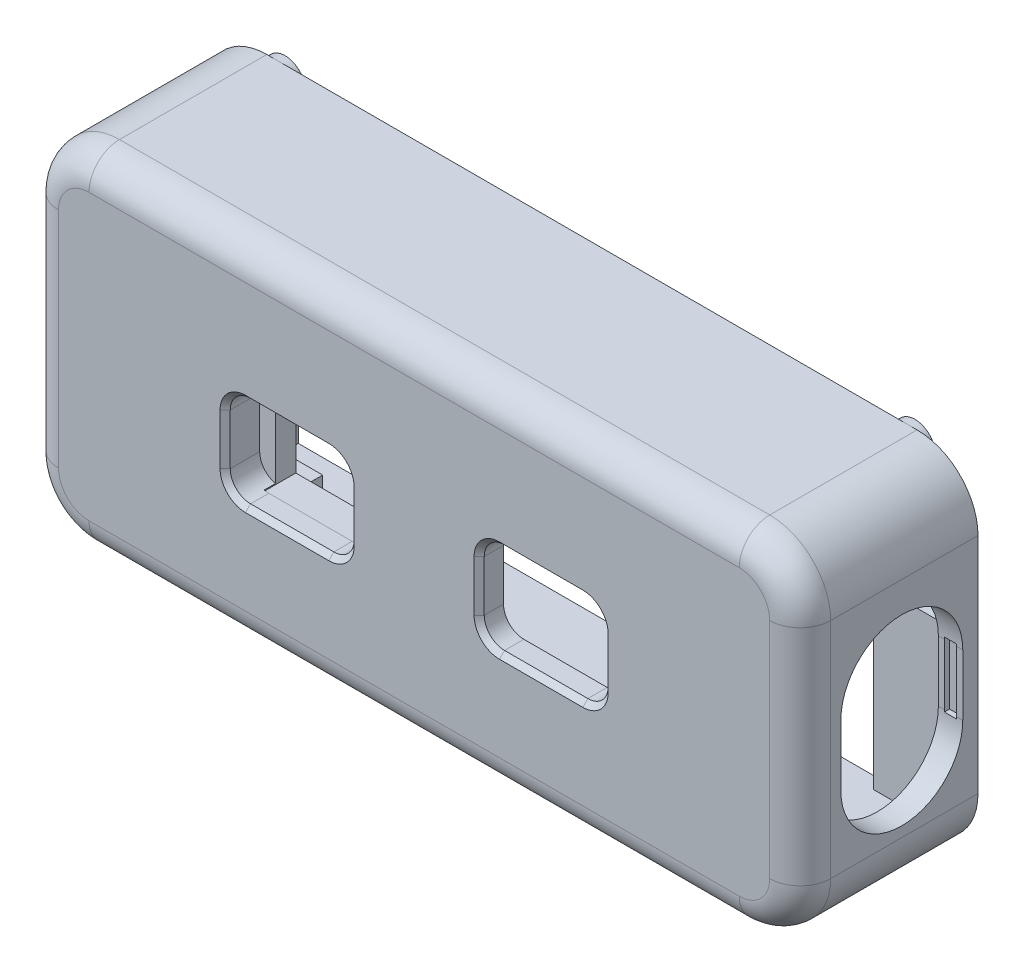
from build123d import *

# Parameters (mm, degrees)
BOSS_EXTRUDE1_START  = 80.8
BOSS_EXTRUDE1_DEPTH  = 17.5
FILLET1_R            = 3
BOSS_EXTRUDE2_START  = 79.8
BOSS_EXTRUDE2_DEPTH  = 16.1
BOSS_EXTRUDE3_START  = 80.8
SKETCH3_W            = 7.2
SKETCH3_H            = 6.31
BOSS_EXTRUDE3_DEPTH  = 6
BOSS_EXTRUDE4_START  = 65.3
BOSS_EXTRUDE4_DEPTH  = 6.31
BOSS_EXTRUDE5_START  = 80.8
SKETCH5_W            = 6.71
SKETCH5_H            = 17.61
BOSS_EXTRUDE5_DEPTH  = 1.2
BOSS_EXTRUDE6_START  = 85.3
SKETCH6_W            = 4
SKETCH6_H            = 3.01
BOSS_EXTRUDE6_DEPTH  = 2
BOSS_EXTRUDE7_START  = 85.3
SKETCH7_W            = 4
SKETCH7_H            = 3.01
BOSS_EXTRUDE7_DEPTH  = 2
BOSS_EXTRUDE8_START  = -39
BOSS_EXTRUDE8_DEPTH  = 3.9
BOSS_EXTRUDE9_START  = 81.8
SKETCH9_W            = 1.2
SKETCH9_H            = 6.4
BOSS_EXTRUDE9_DEPTH  = 0.6
BOSS_EXTRUDE10_START = 94.2
SKETCH10_W           = 1.2
SKETCH10_H           = 6.4
BOSS_EXTRUDE10_DEPTH = 0.6
BOSS_EXTRUDE11_START = 80.8
SKETCH11_W           = 7.2
SKETCH11_H           = 6.31
BOSS_EXTRUDE11_DEPTH = 6
BOSS_EXTRUDE12_START = 65.3
BOSS_EXTRUDE12_DEPTH = 6.31
BOSS_EXTRUDE13_START = 80.8
SKETCH13_W           = 6.71
SKETCH13_H           = 17.61
BOSS_EXTRUDE13_DEPTH = 1.2
BOSS_EXTRUDE14_START = 85.3
SKETCH14_W           = 4
SKETCH14_H           = 3.01
BOSS_EXTRUDE14_DEPTH = 2
BOSS_EXTRUDE15_START = 85.3
SKETCH15_W           = 4
SKETCH15_H           = 3.01
BOSS_EXTRUDE15_DEPTH = 2
BOSS_EXTRUDE16_START = 35.1
BOSS_EXTRUDE16_DEPTH = 3.9
BOSS_EXTRUDE17_START = 81.8
SKETCH17_W           = 1.2
SKETCH17_H           = 6.4
BOSS_EXTRUDE17_DEPTH = 0.6
BOSS_EXTRUDE18_START = 94.2
SKETCH18_W           = 1.2
SKETCH18_H           = 6.4
BOSS_EXTRUDE18_DEPTH = 0.6
BOSS_EXTRUDE19_START = 80
SKETCH19_R           = 2
BOSS_EXTRUDE19_DEPTH = 0.81
BOSS_EXTRUDE20_START = 79.8
SKETCH20_R           = 1
BOSS_EXTRUDE20_DEPTH = 8
BOSS_EXTRUDE21_START = 80
SKETCH21_R           = 2
BOSS_EXTRUDE21_DEPTH = 0.81
BOSS_EXTRUDE22_START = 79.8
SKETCH22_R           = 1
BOSS_EXTRUDE22_DEPTH = 8
BOSS_EXTRUDE23_START = 80
SKETCH23_R           = 2
BOSS_EXTRUDE23_DEPTH = 0.81
BOSS_EXTRUDE24_START = 79.8
SKETCH24_R           = 1
BOSS_EXTRUDE24_DEPTH = 8
BOSS_EXTRUDE25_START = 80
SKETCH25_R           = 2
BOSS_EXTRUDE25_DEPTH = 0.81
BOSS_EXTRUDE26_START = 79.8
SKETCH26_R           = 1
BOSS_EXTRUDE26_DEPTH = 8
BOSS_EXTRUDE27_START = 92.9
SKETCH27_W           = 13
SKETCH27_H           = 13
BOSS_EXTRUDE27_DEPTH = 3.01
BOSS_EXTRUDE28_START = 91.9
SKETCH28_W           = 9.1
SKETCH28_H           = 9.1
BOSS_EXTRUDE28_DEPTH = 4.1
BOSS_EXTRUDE29_START = 93.4
SKETCH29_W           = 20.6
SKETCH29_H           = 6.21
BOSS_EXTRUDE29_DEPTH = 2.51
BOSS_EXTRUDE30_START = 93.4
SKETCH30_W           = 1.2
SKETCH30_H           = 29.22
BOSS_EXTRUDE30_DEPTH = 2.51
BOSS_EXTRUDE31_START = 93.4
SKETCH31_W           = 1.2
SKETCH31_H           = 29.22
BOSS_EXTRUDE31_DEPTH = 2.51
BOSS_EXTRUDE32_START = 94.9
BOSS_EXTRUDE32_DEPTH = 4.4
CHAMFER1_SIZE        = 0.5
BOSS_EXTRUDE33_START = 94.9
BOSS_EXTRUDE33_DEPTH = 4.4
CHAMFER2_SIZE        = 0.5


with BuildPart() as part:
    # Sketch1 → Boss-Extrude1 (new body)
    with BuildSketch(Plane.XY.offset(BOSS_EXTRUDE1_START)):
        with BuildLine():
            Line((-32, 40), (32, 40))
            ThreePointArc((32, 40), (36.242640687, 41.757359313), (38, 46))
            Line((38, 46), (38, 68))
            ThreePointArc((38, 68), (36.242640687, 72.242640687), (32, 74))
            Line((32, 74), (-32, 74))
            ThreePointArc((-32, 74), (-36.242640687, 72.242640687), (-38, 68))
            Line((-38, 68), (-38, 46))
            ThreePointArc((-38, 46), (-36.242640687, 41.757359313), (-32, 40))
        make_face()
    extrude(amount=BOSS_EXTRUDE1_DEPTH)

    # Fillet1
    fillet1_edges = [part.edges().sort_by_distance(p)[0] for p in [
        (36.242640687, 72.242640687, 98.3),
        (38, 57, 98.3),
        (36.242640687, 41.757359313, 98.3),
        (0, 40, 98.3),
        (-36.242640687, 41.757359313, 98.3),
        (-38, 57, 98.3),
        (-36.242640687, 72.242640687, 98.3),
        (0, 74, 98.3),
    ]]
    fillet(fillet1_edges, radius=FILLET1_R)


with BuildPart() as body_2:
    # Sketch2 → Boss-Extrude2 (new body)
    with BuildSketch(Plane.XY.offset(BOSS_EXTRUDE2_START)):
        with BuildLine():
            Line((-32, 42.4), (32, 42.4))
            ThreePointArc((32, 42.4), (34.545584412, 43.454415588), (35.6, 46))
            Line((35.6, 46), (35.6, 68))
            ThreePointArc((35.6, 68), (34.545584412, 70.545584412), (32, 71.6))
            Line((32, 71.6), (-32, 71.6))
            ThreePointArc((-32, 71.6), (-34.545584412, 70.545584412), (-35.6, 68))
            Line((-35.6, 68), (-35.6, 46))
            ThreePointArc((-35.6, 46), (-34.545584412, 43.454415588), (-32, 42.4))
        make_face()
    extrude(amount=BOSS_EXTRUDE2_DEPTH)


with BuildPart() as part_1:
    add(part.part)

    # Combine1: cut body 2
    add(body_2.part, mode=Mode.SUBTRACT)

    # Sketch3 → Boss-Extrude3 (add)
    with BuildSketch(Plane.XY.offset(BOSS_EXTRUDE3_START)):
        with Locations((-32.5, 68.455)):
            Rectangle(SKETCH3_W, SKETCH3_H)
    extrude(amount=BOSS_EXTRUDE3_DEPTH)

    # Sketch4 → Boss-Extrude4 (add)
    with BuildSketch(Plane(origin=(0, 0, 0), x_dir=(1, 0, 0), z_dir=(0, 1, 0)).offset(BOSS_EXTRUDE4_START)):
        Polygon((-28.9, -86.8), (-36.1, -86.8), (-36.1, -94), align=None)
    extrude(amount=BOSS_EXTRUDE4_DEPTH)

    # Sketch5 → Boss-Extrude5 (add)
    with BuildSketch(Plane.XY.offset(BOSS_EXTRUDE5_START)):
        with Locations((-32.255, 51.195)):
            Rectangle(SKETCH5_W, SKETCH5_H)
    extrude(amount=BOSS_EXTRUDE5_DEPTH)

    # Sketch6 → Boss-Extrude6 (add)
    with BuildSketch(Plane.XY.offset(BOSS_EXTRUDE6_START)):
        with Locations((-24, 43.895)):
            Rectangle(SKETCH6_W, SKETCH6_H)
    extrude(amount=BOSS_EXTRUDE6_DEPTH)

    # Sketch7 → Boss-Extrude7 (add)
    with BuildSketch(Plane.XY.offset(BOSS_EXTRUDE7_START)):
        with Locations((-24, 70.105)):
            Rectangle(SKETCH7_W, SKETCH7_H)
    extrude(amount=BOSS_EXTRUDE7_DEPTH)


with BuildPart() as body_2_2:
    # Sketch8 → Boss-Extrude8 (new body)
    with BuildSketch(Plane(origin=(0, 0, 0), x_dir=(0, 0, -1), z_dir=(1, 0, 0)).offset(BOSS_EXTRUDE8_START)):
        with BuildLine():
            Line((-94.3, 53), (-94.3, 59))
            ThreePointArc((-94.3, 59), (-92.542640687, 63.242640687), (-88.3, 65))
            ThreePointArc((-88.3, 65), (-84.057359313, 63.242640687), (-82.3, 59))
            Line((-82.3, 59), (-82.3, 53))
            ThreePointArc((-82.3, 53), (-84.057359313, 48.757359313), (-88.3, 47))
            ThreePointArc((-88.3, 47), (-92.542640687, 48.757359313), (-94.3, 53))
        make_face()
    extrude(amount=BOSS_EXTRUDE8_DEPTH)


with BuildPart() as part_2:
    add(part_1.part)

    # Combine2: cut body 2 2
    add(body_2_2.part, mode=Mode.SUBTRACT)


with BuildPart() as body_2_3:
    # Sketch9 → Boss-Extrude9 (new body)
    with BuildSketch(Plane.XY.offset(BOSS_EXTRUDE9_START)):
        with Locations((-36.8, 56)):
            Rectangle(SKETCH9_W, SKETCH9_H)
    extrude(amount=BOSS_EXTRUDE9_DEPTH)


with BuildPart() as part_3:
    add(part_2.part)

    # Combine3: cut body 2 3
    add(body_2_3.part, mode=Mode.SUBTRACT)


with BuildPart() as body_2_4:
    # Sketch10 → Boss-Extrude10 (new body)
    with BuildSketch(Plane.XY.offset(BOSS_EXTRUDE10_START)):
        with Locations((-36.8, 56)):
            Rectangle(SKETCH10_W, SKETCH10_H)
    extrude(amount=BOSS_EXTRUDE10_DEPTH)


with BuildPart() as part_4:
    add(part_3.part)

    # Combine4: cut body 2 4
    add(body_2_4.part, mode=Mode.SUBTRACT)

    # Sketch11 → Boss-Extrude11 (add)
    with BuildSketch(Plane.XY.offset(BOSS_EXTRUDE11_START)):
        with Locations((32.5, 68.455)):
            Rectangle(SKETCH11_W, SKETCH11_H)
    extrude(amount=BOSS_EXTRUDE11_DEPTH)

    # Sketch12 → Boss-Extrude12 (add)
    with BuildSketch(Plane(origin=(0, 0, 0), x_dir=(1, 0, 0), z_dir=(0, 1, 0)).offset(BOSS_EXTRUDE12_START)):
        Polygon((28.9, -86.8), (36.1, -86.8), (36.1, -94), align=None)
    extrude(amount=BOSS_EXTRUDE12_DEPTH)

    # Sketch13 → Boss-Extrude13 (add)
    with BuildSketch(Plane.XY.offset(BOSS_EXTRUDE13_START)):
        with Locations((32.255, 51.195)):
            Rectangle(SKETCH13_W, SKETCH13_H)
    extrude(amount=BOSS_EXTRUDE13_DEPTH)

    # Sketch14 → Boss-Extrude14 (add)
    with BuildSketch(Plane.XY.offset(BOSS_EXTRUDE14_START)):
        with Locations((24, 43.895)):
            Rectangle(SKETCH14_W, SKETCH14_H)
    extrude(amount=BOSS_EXTRUDE14_DEPTH)

    # Sketch15 → Boss-Extrude15 (add)
    with BuildSketch(Plane.XY.offset(BOSS_EXTRUDE15_START)):
        with Locations((24, 70.105)):
            Rectangle(SKETCH15_W, SKETCH15_H)
    extrude(amount=BOSS_EXTRUDE15_DEPTH)


with BuildPart() as body_2_5:
    # Sketch16 → Boss-Extrude16 (new body)
    with BuildSketch(Plane(origin=(0, 0, 0), x_dir=(0, 0, -1), z_dir=(1, 0, 0)).offset(BOSS_EXTRUDE16_START)):
        with BuildLine():
            Line((-94.3, 53), (-94.3, 59))
            ThreePointArc((-94.3, 59), (-92.542640687, 63.242640687), (-88.3, 65))
            ThreePointArc((-88.3, 65), (-84.057359313, 63.242640687), (-82.3, 59))
            Line((-82.3, 59), (-82.3, 53))
            ThreePointArc((-82.3, 53), (-84.057359313, 48.757359313), (-88.3, 47))
            ThreePointArc((-88.3, 47), (-92.542640687, 48.757359313), (-94.3, 53))
        make_face()
    extrude(amount=BOSS_EXTRUDE16_DEPTH)


with BuildPart() as part_5:
    add(part_4.part)

    # Combine5: cut body 2 5
    add(body_2_5.part, mode=Mode.SUBTRACT)


with BuildPart() as body_2_6:
    # Sketch17 → Boss-Extrude17 (new body)
    with BuildSketch(Plane.XY.offset(BOSS_EXTRUDE17_START)):
        with Locations((36.8, 56)):
            Rectangle(SKETCH17_W, SKETCH17_H)
    extrude(amount=BOSS_EXTRUDE17_DEPTH)


with BuildPart() as part_6:
    add(part_5.part)

    # Combine6: cut body 2 6
    add(body_2_6.part, mode=Mode.SUBTRACT)


with BuildPart() as body_2_7:
    # Sketch18 → Boss-Extrude18 (new body)
    with BuildSketch(Plane.XY.offset(BOSS_EXTRUDE18_START)):
        with Locations((36.8, 56)):
            Rectangle(SKETCH18_W, SKETCH18_H)
    extrude(amount=BOSS_EXTRUDE18_DEPTH)


with BuildPart() as part_7:
    add(part_6.part)

    # Combine7: cut body 2 7
    add(body_2_7.part, mode=Mode.SUBTRACT)

    # Sketch19 → Boss-Extrude19 (add)
    with BuildSketch(Plane.XY.offset(BOSS_EXTRUDE19_START)):
        with Locations((-31, 68.3)):
            Circle(SKETCH19_R)
    extrude(amount=BOSS_EXTRUDE19_DEPTH)


with BuildPart() as body_2_8:
    # Sketch20 → Boss-Extrude20 (new body)
    with BuildSketch(Plane.XY.offset(BOSS_EXTRUDE20_START)):
        with Locations((-31, 68.3)):
            Circle(SKETCH20_R)
    extrude(amount=BOSS_EXTRUDE20_DEPTH)


with BuildPart() as part_8:
    add(part_7.part)

    # Combine8: cut body 2 8
    add(body_2_8.part, mode=Mode.SUBTRACT)

    # Sketch21 → Boss-Extrude21 (add)
    with BuildSketch(Plane.XY.offset(BOSS_EXTRUDE21_START)):
        with Locations((-31, 72)):
            Circle(SKETCH21_R)
    extrude(amount=BOSS_EXTRUDE21_DEPTH)


with BuildPart() as body_2_9:
    # Sketch22 → Boss-Extrude22 (new body)
    with BuildSketch(Plane.XY.offset(BOSS_EXTRUDE22_START)):
        with Locations((-31, 72)):
            Circle(SKETCH22_R)
    extrude(amount=BOSS_EXTRUDE22_DEPTH)


with BuildPart() as part_9:
    add(part_8.part)

    # Combine9: cut body 2 9
    add(body_2_9.part, mode=Mode.SUBTRACT)

    # Sketch23 → Boss-Extrude23 (add)
    with BuildSketch(Plane.XY.offset(BOSS_EXTRUDE23_START)):
        with Locations((31, 68.3)):
            Circle(SKETCH23_R)
    extrude(amount=BOSS_EXTRUDE23_DEPTH)


with BuildPart() as body_2_10:
    # Sketch24 → Boss-Extrude24 (new body)
    with BuildSketch(Plane.XY.offset(BOSS_EXTRUDE24_START)):
        with Locations((31, 68.3)):
            Circle(SKETCH24_R)
    extrude(amount=BOSS_EXTRUDE24_DEPTH)


with BuildPart() as part_10:
    add(part_9.part)

    # Combine10: cut body 2 10
    add(body_2_10.part, mode=Mode.SUBTRACT)

    # Sketch25 → Boss-Extrude25 (add)
    with BuildSketch(Plane.XY.offset(BOSS_EXTRUDE25_START)):
        with Locations((31, 72)):
            Circle(SKETCH25_R)
    extrude(amount=BOSS_EXTRUDE25_DEPTH)


with BuildPart() as body_2_11:
    # Sketch26 → Boss-Extrude26 (new body)
    with BuildSketch(Plane.XY.offset(BOSS_EXTRUDE26_START)):
        with Locations((31, 72)):
            Circle(SKETCH26_R)
    extrude(amount=BOSS_EXTRUDE26_DEPTH)


with BuildPart() as part_11:
    add(part_10.part)

    # Combine11: cut body 2 11
    add(body_2_11.part, mode=Mode.SUBTRACT)

    # Sketch27 → Boss-Extrude27 (add)
    with BuildSketch(Plane.XY.offset(BOSS_EXTRUDE27_START)):
        with Locations((-12.5, 56.4)):
            Rectangle(SKETCH27_W, SKETCH27_H)
    extrude(amount=BOSS_EXTRUDE27_DEPTH)


with BuildPart() as body_2_12:
    # Sketch28 → Boss-Extrude28 (new body)
    with BuildSketch(Plane.XY.offset(BOSS_EXTRUDE28_START)):
        with Locations((-12.5, 56.4)):
            Rectangle(SKETCH28_W, SKETCH28_H)
    extrude(amount=BOSS_EXTRUDE28_DEPTH)


with BuildPart() as part_12:
    add(part_11.part)

    # Combine12: cut body 2 12
    add(body_2_12.part, mode=Mode.SUBTRACT)

    # Sketch29 → Boss-Extrude29 (add)
    with BuildSketch(Plane.XY.offset(BOSS_EXTRUDE29_START)):
        with Locations((12.5, 45.495)):
            Rectangle(SKETCH29_W, SKETCH29_H)
    extrude(amount=BOSS_EXTRUDE29_DEPTH)

    # Sketch30 → Boss-Extrude30 (add)
    with BuildSketch(Plane.XY.offset(BOSS_EXTRUDE30_START)):
        with Locations((1.6, 57)):
            Rectangle(SKETCH30_W, SKETCH30_H)
    extrude(amount=BOSS_EXTRUDE30_DEPTH)

    # Sketch31 → Boss-Extrude31 (add)
    with BuildSketch(Plane.XY.offset(BOSS_EXTRUDE31_START)):
        with Locations((23.4, 57)):
            Rectangle(SKETCH31_W, SKETCH31_H)
    extrude(amount=BOSS_EXTRUDE31_DEPTH)


with BuildPart() as body_2_13:
    # Sketch32 → Boss-Extrude32 (new body)
    with BuildSketch(Plane.XY.offset(BOSS_EXTRUDE32_START)):
        with BuildLine():
            Line((-16.6, 51.9), (-8.4, 51.9))
            ThreePointArc((-8.4, 51.9), (-6.985786438, 52.485786438), (-6.4, 53.9))
            Line((-6.4, 53.9), (-6.4, 58.9))
            ThreePointArc((-6.4, 58.9), (-6.985786438, 60.314213562), (-8.4, 60.9))
            Line((-8.4, 60.9), (-16.6, 60.9))
            ThreePointArc((-16.6, 60.9), (-18.014213562, 60.314213562), (-18.6, 58.9))
            Line((-18.6, 58.9), (-18.6, 53.9))
            ThreePointArc((-18.6, 53.9), (-18.014213562, 52.485786438), (-16.6, 51.9))
        make_face()
    extrude(amount=BOSS_EXTRUDE32_DEPTH)


with BuildPart() as part_13:
    add(part_12.part)

    # Combine13: cut body 2 13
    add(body_2_13.part, mode=Mode.SUBTRACT)

    # Chamfer1
    chamfer1_edges = [part_13.edges().sort_by_distance(p)[0] for p in [
        (-12.5, 51.9, 98.3),
        (-18.014213562, 52.485786438, 98.3),
        (-6.985786438, 52.485786438, 98.3),
        (-18.6, 56.4, 98.3),
        (-6.4, 56.4, 98.3),
        (-18.014213562, 60.314213562, 98.3),
        (-6.985786438, 60.314213562, 98.3),
        (-12.5, 60.9, 98.3),
    ]]
    chamfer(chamfer1_edges, length=CHAMFER1_SIZE)


with BuildPart() as body_2_14:
    # Sketch33 → Boss-Extrude33 (new body)
    with BuildSketch(Plane.XY.offset(BOSS_EXTRUDE33_START)):
        with BuildLine():
            Line((8.4, 51.9), (16.6, 51.9))
            ThreePointArc((16.6, 51.9), (18.014213562, 52.485786438), (18.6, 53.9))
            Line((18.6, 53.9), (18.6, 58.9))
            ThreePointArc((18.6, 58.9), (18.014213562, 60.314213562), (16.6, 60.9))
            Line((16.6, 60.9), (8.4, 60.9))
            ThreePointArc((8.4, 60.9), (6.985786438, 60.314213562), (6.4, 58.9))
            Line((6.4, 58.9), (6.4, 53.9))
            ThreePointArc((6.4, 53.9), (6.985786438, 52.485786438), (8.4, 51.9))
        make_face()
    extrude(amount=BOSS_EXTRUDE33_DEPTH)


with BuildPart() as part_14:
    add(part_13.part)

    # Combine14: cut body 2 14
    add(body_2_14.part, mode=Mode.SUBTRACT)

    # Chamfer2
    chamfer2_edges = [part_14.edges().sort_by_distance(p)[0] for p in [
        (12.5, 51.9, 98.3),
        (6.985786438, 52.485786438, 98.3),
        (18.014213562, 52.485786438, 98.3),
        (6.4, 56.4, 98.3),
        (18.6, 56.4, 98.3),
        (6.985786438, 60.314213562, 98.3),
        (18.014213562, 60.314213562, 98.3),
        (12.5, 60.9, 98.3),
    ]]
    chamfer(chamfer2_edges, length=CHAMFER2_SIZE)


solid = part_14.part
